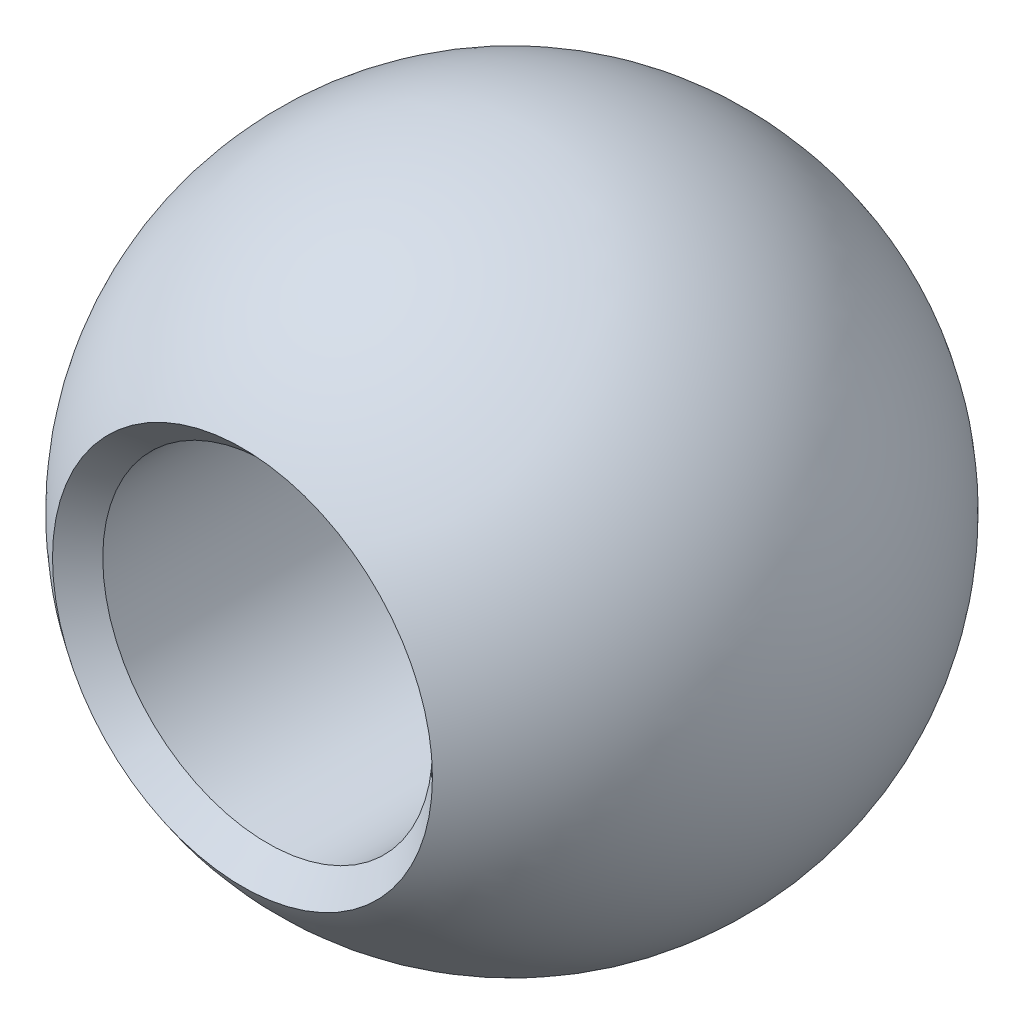
from build123d import *

# Parameters (mm, degrees)
CUT_EXTRUDE_1_DEPTH      = 14.856406461
CUT_EXTRUDE_1_DEPTH_BACK = 14.856406461
SKETCH_2_R               = 4


with BuildPart() as part:
    # Эскиз1 → Повернуть1 (revolve)
    with BuildSketch(Plane.XY):
        with BuildLine():
            Line((0, 8), (0, -8))
            ThreePointArc((0, -8), (8, 0), (0, 8))
        make_face()
    revolve(axis=Axis((0, 8, 0), (0, -1, 0)))

    # Эскиз2 → Вырез-Вытянуть1 (cut, two sides: drawn at the far end of the back side and taken through both)
    with BuildSketch(Plane.XY.offset(-CUT_EXTRUDE_1_DEPTH_BACK)):
        with Locations(Location((0, 0, 0), (0, 0, 180))):
            Circle(SKETCH_2_R)
    extrude(amount=CUT_EXTRUDE_1_DEPTH + CUT_EXTRUDE_1_DEPTH_BACK, mode=Mode.SUBTRACT)

    # Фаска1
    # the kernel refuses this chamfer: 1, 0.732050808 mm, written as the material it takes off along each edge
    with BuildSketch(Plane(origin=(6e-09, 0, -6.92820323), x_dir=(-1, 0, 0), z_dir=(0, 1, 0))) as chamfer_1_piece_1:
        with BuildLine():
            Line((4.609990965, 0.390009042), (3.999999994, 1.000000012))
            Line((3.999999994, 1.000000012), (4.000000006, 0))
            ThreePointArc((4.000000006, 0), (4.313024255, 0.190412663), (4.609990965, 0.390009042))
        make_face()
    revolve(axis=Axis((6e-09, 0, -6.92820323), (0, 0, 1)), mode=Mode.SUBTRACT)
    with BuildSketch(Plane(origin=(6e-09, 0, 6.92820323), x_dir=(-1, 0, 0), z_dir=(0, 1, 0))) as chamfer_1_piece_2:
        with BuildLine():
            Line((4.609990965, -0.390009042), (3.999999994, -1.000000012))
            Line((3.999999994, -1.000000012), (4.000000006, 0))
            ThreePointArc((4.000000006, 0), (4.313024255, -0.190412663), (4.609990965, -0.390009042))
        make_face()
    revolve(axis=Axis((6e-09, 0, 6.92820323), (0, 0, 1)), mode=Mode.SUBTRACT)


solid = part.part
